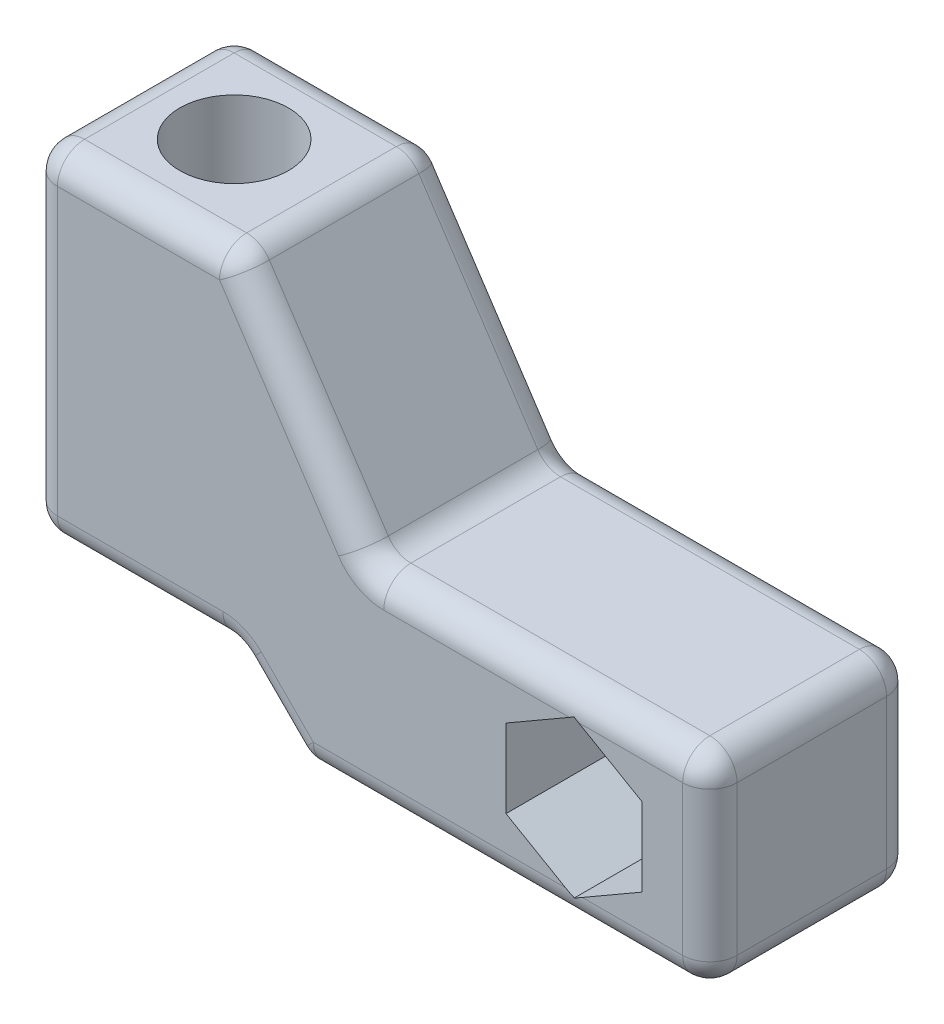
from build123d import *

# Parameters (mm, degrees)
BOSS_EXTRUDE1_DEPTH = 15
SKETCH2_R           = 4.000000000000001
CUT_EXTRUDE1_DEPTH  = 61.20797289396146
CUT_EXTRUDE2_DEPTH  = 15
FILLET1_R           = 2


with BuildPart() as part:
    # Sketch1 → Boss-Extrude1 (new body)
    with BuildSketch(Plane.XY):
        Polygon((0, 0), (15, 0), (19.999999999999982, -5), (49.99999999999999, -5), (49.999999999999986, 10.000000000000002), (24.93349002823336, 9.999999999999998), (15, 24.999999999999993), (0, 24.999999999999996), align=None)
    extrude(amount=BOSS_EXTRUDE1_DEPTH)

    # Sketch2 → Cut-Extrude1 (cut, through all)
    with BuildSketch(Plane(origin=(5.78e-15, 24.999999999999996, 0), x_dir=(1, -2.3e-16, 0), z_dir=(2.3e-16, 1, 0))):
        with Locations(Location((7.499999999999995, -7.5, 0), (0, 0, 180))):
            Circle(SKETCH2_R)
    extrude(amount=-CUT_EXTRUDE1_DEPTH, mode=Mode.SUBTRACT)

    # Sketch3 → Cut-Extrude2 (cut)
    with BuildSketch(Plane.XY.offset(15)):
        Polygon((45, -0.4675632330808986), (45, 5.305939458815377), (39.99999999999999, 8.192690804763508), (34.999999999999986, 5.305939458815372), (34.999999999999986, -0.46756323308090486), (39.999999999999986, -3.354314579029036), align=None)
    extrude(amount=-CUT_EXTRUDE2_DEPTH, mode=Mode.SUBTRACT)

    # Fillet1
    # the kernel refuses this fillet: 2 mm, written as the material it adds along each edge
    with BuildSketch(Plane(origin=(24.93349002823336, 9.999999999999998, 0), x_dir=(-0.5521382091872268, 0.8337525999692728, 0), z_dir=(0, 0, 1))) as fillet1_piece_1:
        with BuildLine():
            CenterArc((FILLET1_R * 0.537163891098, -FILLET1_R), FILLET1_R, 90.00000000000004, 56.486172927445)
            Line((-FILLET1_R * 0.296588708871, -FILLET1_R * 0.447861790813), (0, 0))
            Line((0, 0), (FILLET1_R * 0.537163891098, -7e-17))
        make_face()
    extrude(amount=15)
    with BuildSketch(Plane(origin=(15, 0, 0), x_dir=(-1, 0, 0), z_dir=(0, 0, 1))) as fillet1_piece_2:
        with BuildLine():
            CenterArc((FILLET1_R * 0.414213562373, FILLET1_R), FILLET1_R, 224.99999999999994, 45.00000000000006)
            Line((-FILLET1_R * 0.292893218813, FILLET1_R * 0.292893218813), (0, 0))
            Line((0, 0), (FILLET1_R * 0.414213562373, 0))
        make_face()
    extrude(amount=15)
    # the kernel refuses this fillet: 2 mm, written as the material it takes off along each edge
    with BuildSketch(Plane(origin=(2, 2, 13), x_dir=(0, 0, 1), z_dir=(0, -1, 0))) as fillet1_2_piece_1_section:
        Polygon((0, 0), (FILLET1_R, 0), (FILLET1_R, FILLET1_R), (0, FILLET1_R), align=None)
    fillet1_2_piece_1 = extrude(amount=FILLET1_R, mode=Mode.PRIVATE)
    fillet1_2_piece_1 = fillet1_2_piece_1 - Plane(origin=(2, 2, 13), x_dir=(0.7071067811865475, 0, -0.7071067811865475), z_dir=(0, -1, 0)) * Sphere(FILLET1_R, mode=Mode.PRIVATE)
    add(fillet1_2_piece_1, mode=Mode.SUBTRACT)
    with BuildSketch(Plane(origin=(2, 22.999999999999996, 2), x_dir=(-1, 0, 0), z_dir=(0, 0, -1))) as fillet1_2_piece_2_section:
        Polygon((0, 0), (FILLET1_R, 0), (FILLET1_R, FILLET1_R), (-4.7e-16, FILLET1_R), align=None)
    fillet1_2_piece_2 = extrude(amount=FILLET1_R, mode=Mode.PRIVATE)
    fillet1_2_piece_2 = fillet1_2_piece_2 - Plane(origin=(2, 22.999999999999996, 2), x_dir=(0.7071067811865475, -0.7071067811865476, 0), z_dir=(0, 0, -1)) * Sphere(FILLET1_R, mode=Mode.PRIVATE)
    add(fillet1_2_piece_2, mode=Mode.SUBTRACT)
    with BuildSketch(Plane(origin=(2, 2, 2), x_dir=(0, 0, -1), z_dir=(0, -1, 0))) as fillet1_2_piece_3_section:
        Polygon((0, 0), (FILLET1_R, 0), (FILLET1_R, -FILLET1_R), (0, -FILLET1_R), align=None)
    fillet1_2_piece_3 = extrude(amount=FILLET1_R, mode=Mode.PRIVATE)
    fillet1_2_piece_3 = fillet1_2_piece_3 - Plane(origin=(2, 2, 2), x_dir=(0.7071067811865475, 0, 0.7071067811865475), z_dir=(0, -1, 0)) * Sphere(FILLET1_R, mode=Mode.PRIVATE)
    add(fillet1_2_piece_3, mode=Mode.SUBTRACT)
    with BuildSketch(Plane(origin=(13.92567221780351, 22.999999999999993, 2), x_dir=(0.8337525999692725, 0.5521382091872273, 0), z_dir=(0, 0, -1))) as fillet1_2_piece_4_section:
        Polygon((0, 0), (FILLET1_R, -3e-17), (FILLET1_R, -FILLET1_R * 0.537163891098), (FILLET1_R * 0.552138209187, -FILLET1_R * 0.833752599969), align=None)
    fillet1_2_piece_4 = extrude(amount=FILLET1_R, mode=Mode.PRIVATE)
    fillet1_2_piece_4 = fillet1_2_piece_4 - Plane(origin=(13.92567221780351, 22.999999999999993, 2), x_dir=(-0.47321337196489544, -0.8809478444230473, 0), z_dir=(0, 0, -1)) * Sphere(FILLET1_R, mode=Mode.PRIVATE)
    add(fillet1_2_piece_4, mode=Mode.SUBTRACT)
    with BuildSketch(Plane(origin=(20.828427124746174, -3, 13), x_dir=(-0.7071067811865488, -0.7071067811865462, 0), z_dir=(0, 0, 1))) as fillet1_2_piece_5_section:
        Polygon((0, 0), (FILLET1_R, -2e-17), (FILLET1_R, FILLET1_R * 0.414213562373), (FILLET1_R * 0.707106781187, FILLET1_R * 0.707106781187), align=None)
    fillet1_2_piece_5 = extrude(amount=FILLET1_R, mode=Mode.PRIVATE)
    fillet1_2_piece_5 = fillet1_2_piece_5 - Plane(origin=(20.828427124746174, -3, 13), x_dir=(0.3826834323650906, 0.9238795325112864, 0), z_dir=(0, 0, 1)) * Sphere(FILLET1_R, mode=Mode.PRIVATE)
    add(fillet1_2_piece_5, mode=Mode.SUBTRACT)
    with BuildSketch(Plane(origin=(13.925672217803509, 22.999999999999996, 13), x_dir=(2.4e-16, 1, 0), z_dir=(0, 0, 1))) as fillet1_2_piece_6_section:
        Polygon((0, 0), (FILLET1_R, 0), (FILLET1_R, -FILLET1_R * 0.537163891098), (FILLET1_R * 0.552138209187, -FILLET1_R * 0.833752599969), align=None)
    fillet1_2_piece_6 = extrude(amount=FILLET1_R, mode=Mode.PRIVATE)
    fillet1_2_piece_6 = fillet1_2_piece_6 - Plane(origin=(13.925672217803509, 22.999999999999996, 13), x_dir=(-0.47321337196489544, -0.8809478444230473, 0), z_dir=(0, 0, 1)) * Sphere(FILLET1_R, mode=Mode.PRIVATE)
    add(fillet1_2_piece_6, mode=Mode.SUBTRACT)
    with BuildSketch(Plane(origin=(47.999999999999986, 8.000000000000002, 2), x_dir=(1, 4.7e-16, 0), z_dir=(0, 0, -1))) as fillet1_2_piece_7_section:
        Polygon((0, 0), (FILLET1_R, 0), (FILLET1_R, -FILLET1_R), (6.6e-16, -FILLET1_R), align=None)
    fillet1_2_piece_7 = extrude(amount=FILLET1_R, mode=Mode.PRIVATE)
    fillet1_2_piece_7 = fillet1_2_piece_7 - Plane(origin=(47.999999999999986, 8.000000000000002, 2), x_dir=(-0.7071067811865472, -0.7071067811865477, 0), z_dir=(0, 0, -1)) * Sphere(FILLET1_R, mode=Mode.PRIVATE)
    add(fillet1_2_piece_7, mode=Mode.SUBTRACT)
    with BuildSketch(Plane(origin=(47.999999999999986, 8.000000000000002, 13), x_dir=(1, 4.7e-16, 0), z_dir=(0, 0, 1))) as fillet1_2_piece_8_section:
        Polygon((0, 0), (FILLET1_R, 0), (FILLET1_R, FILLET1_R), (6.6e-16, FILLET1_R), align=None)
    fillet1_2_piece_8 = extrude(amount=FILLET1_R, mode=Mode.PRIVATE)
    fillet1_2_piece_8 = fillet1_2_piece_8 - Plane(origin=(47.999999999999986, 8.000000000000002, 13), x_dir=(-0.7071067811865472, -0.7071067811865477, 0), z_dir=(0, 0, 1)) * Sphere(FILLET1_R, mode=Mode.PRIVATE)
    add(fillet1_2_piece_8, mode=Mode.SUBTRACT)
    with BuildSketch(Plane(origin=(47.99999999999999, -3, 2), x_dir=(0, 0, -1), z_dir=(0, -1, 0))) as fillet1_2_piece_9_section:
        Polygon((0, 0), (FILLET1_R, 0), (FILLET1_R, FILLET1_R), (0, FILLET1_R), align=None)
    fillet1_2_piece_9 = extrude(amount=FILLET1_R, mode=Mode.PRIVATE)
    fillet1_2_piece_9 = fillet1_2_piece_9 - Plane(origin=(47.99999999999999, -3, 2), x_dir=(-0.7071067811865475, 0, 0.7071067811865475), z_dir=(0, -1, 0)) * Sphere(FILLET1_R, mode=Mode.PRIVATE)
    add(fillet1_2_piece_9, mode=Mode.SUBTRACT)
    with BuildSketch(Plane(origin=(47.99999999999999, -3, 13), x_dir=(1, 4.7e-16, 0), z_dir=(0, -1, 0))) as fillet1_2_piece_10_section:
        Polygon((0, 0), (FILLET1_R, 0), (FILLET1_R, FILLET1_R), (0, FILLET1_R), align=None)
    fillet1_2_piece_10 = extrude(amount=FILLET1_R, mode=Mode.PRIVATE)
    fillet1_2_piece_10 = fillet1_2_piece_10 - Plane(origin=(47.99999999999999, -3, 13), x_dir=(-0.7071067811865475, 0, -0.7071067811865475), z_dir=(0, -1, 0)) * Sphere(FILLET1_R, mode=Mode.PRIVATE)
    add(fillet1_2_piece_10, mode=Mode.SUBTRACT)
    with BuildSketch(Plane(origin=(20.828427124746174, -3, 2), x_dir=(-0.7071067811865488, -0.7071067811865462, 0), z_dir=(0, 0, -1))) as fillet1_2_piece_11_section:
        Polygon((0, 0), (FILLET1_R, 2e-17), (FILLET1_R, -FILLET1_R * 0.414213562373), (FILLET1_R * 0.707106781187, -FILLET1_R * 0.707106781187), align=None)
    fillet1_2_piece_11 = extrude(amount=FILLET1_R, mode=Mode.PRIVATE)
    fillet1_2_piece_11 = fillet1_2_piece_11 - Plane(origin=(20.828427124746174, -3, 2), x_dir=(0.3826834323650906, 0.9238795325112864, 0), z_dir=(0, 0, -1)) * Sphere(FILLET1_R, mode=Mode.PRIVATE)
    add(fillet1_2_piece_11, mode=Mode.SUBTRACT)
    with BuildSketch(Plane(origin=(2, 22.999999999999996, 13), x_dir=(-1, 0, 0), z_dir=(0, 0, 1))) as fillet1_2_piece_12_section:
        Polygon((0, 0), (FILLET1_R, 0), (FILLET1_R, -FILLET1_R), (-4.7e-16, -FILLET1_R), align=None)
    fillet1_2_piece_12 = extrude(amount=FILLET1_R, mode=Mode.PRIVATE)
    fillet1_2_piece_12 = fillet1_2_piece_12 - Plane(origin=(2, 22.999999999999996, 13), x_dir=(0.7071067811865475, -0.7071067811865476, 0), z_dir=(0, 0, 1)) * Sphere(FILLET1_R, mode=Mode.PRIVATE)
    add(fillet1_2_piece_12, mode=Mode.SUBTRACT)
    with BuildSketch(Plane(origin=(1.9999999999999998, 0, 15), x_dir=(0, 0, -1), z_dir=(1, 0, 0))) as fillet1_2_piece_13:
        with BuildLine():
            CenterArc((FILLET1_R, FILLET1_R), FILLET1_R, 180, 90)
            Line((0, FILLET1_R), (0, 0))
            Line((0, 0), (FILLET1_R, 0))
        make_face()
    extrude(amount=12.171572875253808, mode=Mode.SUBTRACT)
    with BuildSketch(Plane(origin=(0, 22.999999999999996, 0), x_dir=(1, 0, 0), z_dir=(0, -1, 0))) as fillet1_2_piece_14:
        with BuildLine():
            CenterArc((FILLET1_R, FILLET1_R), FILLET1_R, 180, 90)
            Line((0, FILLET1_R), (0, 0))
            Line((0, 0), (FILLET1_R, 0))
        make_face()
    extrude(amount=20.999999999999996, mode=Mode.SUBTRACT)
    with BuildSketch(Plane(origin=(13.92567221780351, 24.999999999999993, 0), x_dir=(-2.4e-16, -1, 0), z_dir=(-1, 2.4e-16, 0))) as fillet1_2_piece_15:
        with BuildLine():
            CenterArc((FILLET1_R, FILLET1_R), FILLET1_R, 180, 90)
            Line((0, FILLET1_R), (0, 0))
            Line((0, 0), (FILLET1_R, 0))
        make_face()
    extrude(amount=11.92567221780351, mode=Mode.SUBTRACT)
    with BuildSketch(Plane(origin=(15.585786437626904, -0.5857864376269062, 15), x_dir=(0.7071067811865488, 0.7071067811865462, 0), z_dir=(0.7071067811865462, -0.7071067811865488, 0))) as fillet1_2_piece_16:
        with BuildLine():
            CenterArc((FILLET1_R, -FILLET1_R), FILLET1_R, 90, 90)
            Line((-1.88e-15, -FILLET1_R), (0, 0))
            Line((0, 0), (FILLET1_R, 0))
        make_face()
    extrude(amount=5.4142135623730825, mode=Mode.SUBTRACT)
    with BuildSketch(Plane(origin=(15, 24.999999999999993, 2), x_dir=(-1, 0, 0), z_dir=(0, 0, 1))) as fillet1_2_piece_17:
        with BuildLine():
            CenterArc((FILLET1_R * 0.537163891098, FILLET1_R), FILLET1_R, 213.5138270725551, 56.4861729274449)
            Line((-FILLET1_R * 0.296588708871, FILLET1_R * 0.447861790813), (0, 0))
            Line((0, 0), (FILLET1_R * 0.537163891098, 0))
        make_face()
    extrude(amount=11, mode=Mode.SUBTRACT)
    with BuildSketch(Plane(origin=(49.999999999999986, 10.000000000000002, 2), x_dir=(0, -1, 0), z_dir=(0, 0, 1))) as fillet1_2_piece_18:
        with BuildLine():
            CenterArc((FILLET1_R, -FILLET1_R), FILLET1_R, 90.00000000000006, 89.99999999999994)
            Line((1.78e-15, -FILLET1_R), (0, 0))
            Line((0, 0), (FILLET1_R, 0))
        make_face()
    extrude(amount=11, mode=Mode.SUBTRACT)
    with BuildSketch(Plane(origin=(49.99999999999999, -5, 2), x_dir=(-1, 0, 0), z_dir=(0, 0, 1))) as fillet1_2_piece_19:
        with BuildLine():
            CenterArc((FILLET1_R, -FILLET1_R), FILLET1_R, 90, 90)
            Line((0, -FILLET1_R), (0, 0))
            Line((0, 0), (FILLET1_R, 0))
        make_face()
    extrude(amount=11, mode=Mode.SUBTRACT)
    with BuildSketch(Plane(origin=(19.999999999999982, -5, 2), x_dir=(-0.7071067811865454, 0.7071067811865497, 0), z_dir=(0, 0, 1))) as fillet1_2_piece_20:
        with BuildLine():
            CenterArc((FILLET1_R * 0.414213562373, -FILLET1_R), FILLET1_R, 90.00000000000001, 45.00000000000007)
            Line((-FILLET1_R * 0.292893218813, -FILLET1_R * 0.292893218813), (0, 0))
            Line((0, 0), (FILLET1_R * 0.414213562373, 1e-17))
        make_face()
    extrude(amount=11, mode=Mode.SUBTRACT)
    with BuildSketch(Plane(origin=(0, 0, 2), x_dir=(1, 0, 0), z_dir=(0, 0, 1))) as fillet1_2_piece_21:
        with BuildLine():
            CenterArc((FILLET1_R, FILLET1_R), FILLET1_R, 180, 90)
            Line((-2.2e-16, FILLET1_R), (0, 0))
            Line((0, 0), (FILLET1_R, 0))
        make_face()
    extrude(amount=11, mode=Mode.SUBTRACT)
    with BuildSketch(Plane(origin=(0, 24.999999999999996, 2), x_dir=(0, -1, 0), z_dir=(0, 0, 1))) as fillet1_2_piece_22:
        with BuildLine():
            CenterArc((FILLET1_R, FILLET1_R), FILLET1_R, 180, 90)
            Line((0, FILLET1_R), (0, 0))
            Line((0, 0), (FILLET1_R, 0))
        make_face()
    extrude(amount=11, mode=Mode.SUBTRACT)
    with BuildSketch(Plane(origin=(20.828427124746174, -5, 15), x_dir=(0, 1, 0), z_dir=(1, 0, 0))) as fillet1_2_piece_23:
        with BuildLine():
            CenterArc((FILLET1_R, -FILLET1_R), FILLET1_R, 90, 90)
            Line((8.9e-16, -FILLET1_R), (0, 0))
            Line((0, 0), (FILLET1_R, 0))
        make_face()
    extrude(amount=27.17157287525382, mode=Mode.SUBTRACT)
    with BuildSketch(Plane(origin=(49.99999999999999, -2.999999999999999, 15), x_dir=(-1, -4.7e-16, 0), z_dir=(-4.7e-16, 1, 0))) as fillet1_2_piece_24:
        with BuildLine():
            CenterArc((FILLET1_R, -FILLET1_R), FILLET1_R, 90, 90)
            Line((0, -FILLET1_R), (0, 0))
            Line((0, 0), (FILLET1_R, 0))
        make_face()
    extrude(amount=11.000000000000004, mode=Mode.SUBTRACT)
    with BuildSketch(Plane(origin=(47.999999999999986, 10.000000000000002, 15), x_dir=(1.4e-16, -1, 0), z_dir=(-1, -1.4e-16, 0))) as fillet1_2_piece_25:
        with BuildLine():
            CenterArc((FILLET1_R, -FILLET1_R), FILLET1_R, 90, 90)
            Line((0, -FILLET1_R), (0, 0))
            Line((0, 0), (FILLET1_R, 0))
        make_face()
    extrude(amount=21.992182189570133, mode=Mode.SUBTRACT)
    with BuildSketch(Plane(origin=(24.340312610491306, 10.895723581625546, 15), x_dir=(-0.8337525999692724, -0.5521382091872273, 0), z_dir=(-0.5521382091872273, 0.8337525999692725, 0))) as fillet1_2_piece_26:
        with BuildLine():
            CenterArc((FILLET1_R, -FILLET1_R), FILLET1_R, 90, 90)
            Line((-9.8e-16, -FILLET1_R), (0, 0))
            Line((0, 0), (FILLET1_R, 0))
        make_face()
    extrude(amount=15.842292830314058, mode=Mode.SUBTRACT)
    with BuildSketch(Plane(origin=(13.925672217803509, 24.999999999999993, 15), x_dir=(-2.4e-16, -1, 0), z_dir=(-1, 2.4e-16, 0))) as fillet1_2_piece_27:
        with BuildLine():
            CenterArc((FILLET1_R, -FILLET1_R), FILLET1_R, 90, 90)
            Line((0, -FILLET1_R), (0, 0))
            Line((0, 0), (FILLET1_R, 0))
        make_face()
    extrude(amount=11.925672217803509, mode=Mode.SUBTRACT)
    with BuildSketch(Plane(origin=(0, 22.999999999999996, 15), x_dir=(1, 0, 0), z_dir=(0, -1, 0))) as fillet1_2_piece_28:
        with BuildLine():
            CenterArc((FILLET1_R, -FILLET1_R), FILLET1_R, 90, 90)
            Line((0, -FILLET1_R), (0, 0))
            Line((0, 0), (FILLET1_R, 0))
        make_face()
    extrude(amount=20.999999999999996, mode=Mode.SUBTRACT)
    with BuildSketch(Plane(origin=(24.340312610491306, 10.895723581625546, 0), x_dir=(-0.8337525999692724, -0.5521382091872273, 0), z_dir=(-0.5521382091872273, 0.8337525999692725, 0))) as fillet1_2_piece_29:
        with BuildLine():
            CenterArc((FILLET1_R, FILLET1_R), FILLET1_R, 180, 90)
            Line((-9.8e-16, FILLET1_R), (0, 0))
            Line((0, 0), (FILLET1_R, 0))
        make_face()
    extrude(amount=15.84229283031405, mode=Mode.SUBTRACT)
    with BuildSketch(Plane(origin=(47.999999999999986, 10.000000000000002, 0), x_dir=(1.4e-16, -1, 0), z_dir=(-1, -1.4e-16, 0))) as fillet1_2_piece_30:
        with BuildLine():
            CenterArc((FILLET1_R, FILLET1_R), FILLET1_R, 180, 90)
            Line((0, FILLET1_R), (0, 0))
            Line((0, 0), (FILLET1_R, 0))
        make_face()
    extrude(amount=21.992182189570133, mode=Mode.SUBTRACT)
    with BuildSketch(Plane(origin=(49.99999999999999, -2.999999999999999, 0), x_dir=(-1, -4.7e-16, 0), z_dir=(-4.7e-16, 1, 0))) as fillet1_2_piece_31:
        with BuildLine():
            CenterArc((FILLET1_R, FILLET1_R), FILLET1_R, 180, 90)
            Line((0, FILLET1_R), (0, 0))
            Line((0, 0), (FILLET1_R, 0))
        make_face()
    extrude(amount=11.000000000000004, mode=Mode.SUBTRACT)
    with BuildSketch(Plane(origin=(20.828427124746174, -5, 0), x_dir=(0, 1, 0), z_dir=(1, 0, 0))) as fillet1_2_piece_32:
        with BuildLine():
            CenterArc((FILLET1_R, FILLET1_R), FILLET1_R, 180, 90)
            Line((8.9e-16, FILLET1_R), (0, 0))
            Line((0, 0), (FILLET1_R, 0))
        make_face()
    extrude(amount=27.17157287525382, mode=Mode.SUBTRACT)
    with BuildSketch(Plane(origin=(15.585786437626904, -0.5857864376269062, 0), x_dir=(0.7071067811865488, 0.7071067811865462, 0), z_dir=(0.7071067811865462, -0.7071067811865488, 0))) as fillet1_2_piece_33:
        with BuildLine():
            CenterArc((FILLET1_R, FILLET1_R), FILLET1_R, 180, 90)
            Line((-1.88e-15, FILLET1_R), (0, 0))
            Line((0, 0), (FILLET1_R, 0))
        make_face()
    extrude(amount=5.4142135623730825, mode=Mode.SUBTRACT)
    with BuildSketch(Plane(origin=(1.9999999999999998, 0, 0), x_dir=(0, 0, 1), z_dir=(1, 0, 0))) as fillet1_2_piece_34:
        with BuildLine():
            CenterArc((FILLET1_R, -FILLET1_R), FILLET1_R, 90, 90)
            Line((-2.2e-16, -FILLET1_R), (0, 0))
            Line((0, 0), (FILLET1_R, 0))
        make_face()
    extrude(amount=12.171572875253808, mode=Mode.SUBTRACT)
    with BuildSketch(Plane(origin=(14.171572875253808, -2, 0), x_dir=(0, 1, 0), z_dir=(-1, 0, 0))) as fillet1_2_piece_35:
        with BuildLine():
            CenterArc((2 + FILLET1_R, -FILLET1_R), FILLET1_R, 90, 90)
            Line((2, -FILLET1_R), (2, 0))
            Line((2, 0), (2 + FILLET1_R, 0))
        make_face()
    revolve(axis=Axis((14.171572875253808, -2, 0), (0, 0, -1)), revolution_arc=45.00000000000004, mode=Mode.SUBTRACT)
    with BuildSketch(Plane(origin=(26.007817810429852, 12, 0), x_dir=(-0.8337525999692728, -0.5521382091872268, 0), z_dir=(-0.5521382091872268, 0.8337525999692728, 0))) as fillet1_2_piece_36:
        with BuildLine():
            CenterArc((2.0000000000000004 + FILLET1_R, FILLET1_R), FILLET1_R, 180, 90)
            Line((1.9999999999999996, FILLET1_R), (2.0000000000000004, 0))
            Line((2.0000000000000004, 0), (2.0000000000000004 + FILLET1_R, 0))
        make_face()
    revolve(axis=Axis((26.007817810429852, 12, 0), (0, 0, 1)), revolution_arc=56.486172927445004, mode=Mode.SUBTRACT)
    with BuildSketch(Plane(origin=(26.007817810429852, 12, 15), x_dir=(-0.8337525999692728, -0.5521382091872268, 0), z_dir=(-0.5521382091872268, 0.8337525999692728, 0))) as fillet1_2_piece_37:
        with BuildLine():
            CenterArc((2.0000000000000004 + FILLET1_R, -FILLET1_R), FILLET1_R, 90, 90)
            Line((1.9999999999999996, -FILLET1_R), (2.0000000000000004, 0))
            Line((2.0000000000000004, 0), (2.0000000000000004 + FILLET1_R, 0))
        make_face()
    revolve(axis=Axis((26.007817810429852, 12, 15), (0, 0, 1)), revolution_arc=56.486172927445004, mode=Mode.SUBTRACT)
    with BuildSketch(Plane(origin=(14.171572875253808, -2, 15), x_dir=(0, 1, 0), z_dir=(-1, 0, 0))) as fillet1_2_piece_38:
        with BuildLine():
            CenterArc((2 + FILLET1_R, FILLET1_R), FILLET1_R, 180, 90)
            Line((2 + FILLET1_R, 0), (2, 0))
            Line((2, 0), (2, FILLET1_R))
        make_face()
    revolve(axis=Axis((14.171572875253808, -2, 15), (0, 0, -1)), revolution_arc=45.00000000000004, mode=Mode.SUBTRACT)


solid = part.part
